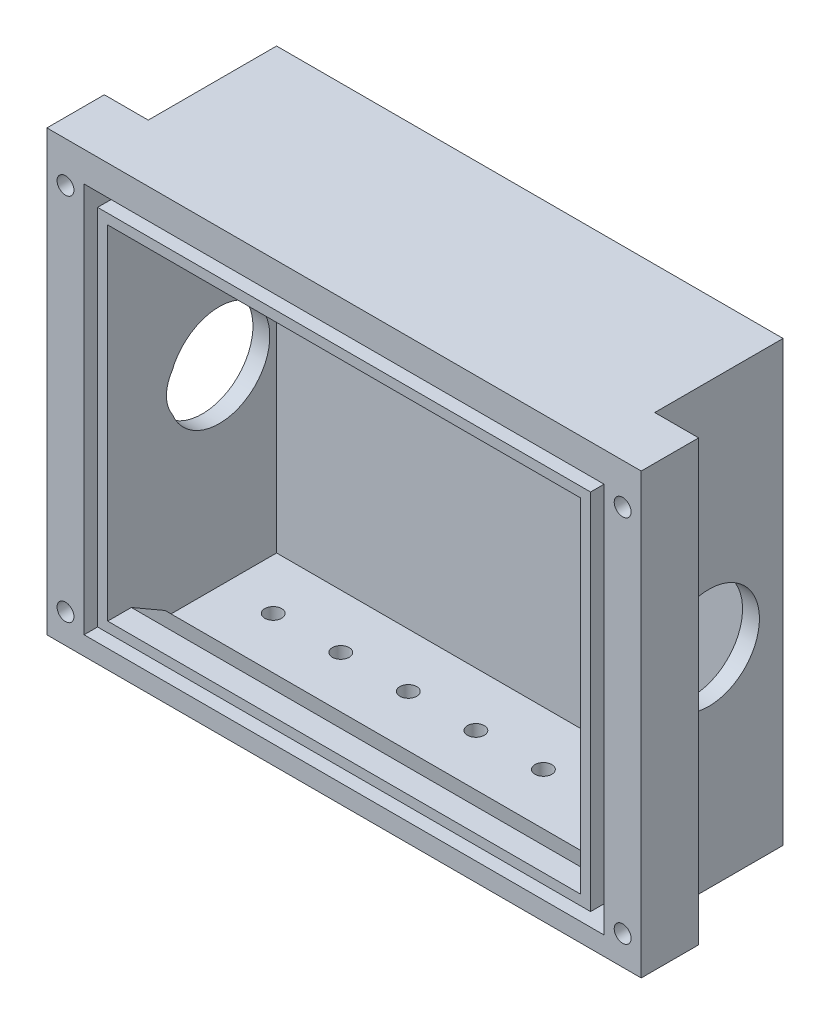
from build123d import *
from OCP.BRepFilletAPI import BRepFilletAPI_MakeChamfer

# Parameters (mm, degrees)
SKETCH1_R               = 172.5
BOSS_EXTRUDE1_DEPTH     = 10
SKETCH2_R               = 48.41
CUT_EXTRUDE1_DEPTH      = 10
BOSS_EXTRUDE2_DEPTH     = 5
CUT_EXTRUDE2_DEPTH      = 497
CUT_EXTRUDE6_START      = -497
CUT_EXTRUDE6_DEPTH      = 497
SKETCH6_W               = 195.767044214
SKETCH6_H               = 55
SKETCH6_W_2             = 185.767044214
SKETCH6_H_2             = 45
BOSS_EXTRUDE3_DEPTH     = 133.35
SKETCH7_W               = 185.767044214
SKETCH7_H               = 45
BOSS_EXTRUDE4_DEPTH     = 5
BOSS_EXTRUDE5_DEPTH     = 8
CHAMFER1_SIZE           = 8
CHAMFER1_SIZE2          = 6.250285012
CHAMFER1_PART_2_SIZE    = 8
CHAMFER1_PART_2_SIZE2   = 6.250285012
CHAMFER1_PART_3_SIZE    = 8
CHAMFER1_PART_3_SIZE2   = 6.250285012
FILLET1_R               = 38
SKETCH9_R               = 374.079334695
CUT_EXTRUDE7_DEPTH      = 93
CUT_EXTRUDE8_DEPTH      = 93
CUT_EXTRUDE8_DEPTH_BACK = 93
SKETCH10_R              = 229.38613092
SKETCH10_R_2            = 152.4
SKETCH11_W              = 291.443368419
SKETCH11_H              = 134.798764099
SKETCH11_W_2            = 144.967044214
SKETCH11_H_2            = 55
CUT_EXTRUDE9_DEPTH      = 143
SKETCH12_W              = 5
SKETCH12_H              = 55
BOSS_EXTRUDE6_DEPTH     = 133.35
SKETCH13_R              = 10
CUT_EXTRUDE10_DEPTH     = 58
SKETCH14_W              = 139.967044214
SKETCH14_H              = 45
BOSS_EXTRUDE7_DEPTH     = 5
SKETCH15_W              = 139.967044214
SKETCH15_H              = 123.35
CUT_EXTRUDE11_DEPTH     = 13
SKETCH16_W              = 10
SKETCH16_H              = 133.35
SKETCH16_W_2            = 149.967044214
BOSS_EXTRUDE9_DEPTH     = 17
SKETCH17_W              = 153.967044214
SKETCH17_H              = 115.6
SKETCH17_W_2            = 145.967044214
SKETCH17_H_2            = 107.6
CUT_EXTRUDE12_DEPTH     = 10
CHAMFER2_SIZE           = 10
CHAMFER2_SIZE2          = 5.773502692
SKETCH24_R              = 15
CUT_EXTRUDE16_DEPTH     = 177.5
SKETCH20_W              = 169.967044214
SKETCH20_H              = 3.35
CUT_EXTRUDE17_DEPTH     = 177.5
SKETCH25_W              = 139.967044214
SKETCH25_H              = 38.773502692
BOSS_EXTRUDE11_DEPTH    = 5
SKETCH26_W              = 3
SKETCH26_H              = 130
BOSS_EXTRUDE12_DEPTH    = 17
SKETCH18_R              = 2.5
CUT_EXTRUDE19_DEPTH     = 26
SKETCH27_W              = 48
SKETCH27_H              = 5
CUT_EXTRUDE20_DEPTH     = 23
SKETCH28_R              = 2.5
CUT_EXTRUDE21_DEPTH     = 10
SKETCH29_W              = 15
SKETCH29_H              = 30
BOSS_EXTRUDE13_DEPTH    = 10
SKETCH30_W              = 4
SKETCH30_H              = 23
CUT_EXTRUDE22_DEPTH     = 21
CHAMFER3_SIZE           = 6


with BuildPart() as part:
    # Sketch1 → Boss-Extrude1 (new body)
    with BuildSketch(Plane(origin=(0, 0, 0), x_dir=(1, 0, 0), z_dir=(0, 1, 0))):
        with Locations(Location((0, 0, 0), (0, 0, 270))):
            Circle(SKETCH1_R)
    extrude(amount=BOSS_EXTRUDE1_DEPTH)

    # Sketch2 → Cut-Extrude1 (cut)
    with BuildSketch(Plane(origin=(0, 10, 0), x_dir=(1, 0, 0), z_dir=(0, 1, 0))):
        with Locations((-75.91, -178.72)):
            Circle(SKETCH2_R)
        with Locations((75.91, -178.72)):
            Circle(SKETCH2_R)
    extrude(amount=-CUT_EXTRUDE1_DEPTH, mode=Mode.SUBTRACT)

    # Sketch3 → Boss-Extrude2 (add)
    with BuildSketch(Plane(origin=(0, 10, 0), x_dir=(1, 0, 0), z_dir=(0, 1, 0))):
        with BuildLine():
            Line((-98.968297449, -119.81), (98.968297449, -119.81))
            ThreePointArc((98.968297449, -119.81), (0, 155.4), (-98.968297449, -119.81))
        make_face()
        with BuildLine():
            ThreePointArc((97.883522107, -116.81), (0, 152.4), (-97.883522107, -116.81))
            Line((-97.883522107, -116.81), (97.883522107, -116.81))
        make_face(mode=Mode.SUBTRACT)
    extrude(amount=BOSS_EXTRUDE2_DEPTH)

    # Sketch4 → Cut-Extrude2 (cut)
    with BuildSketch(Plane(origin=(0, 10, 0), x_dir=(1, 0, 0), z_dir=(0, 1, 0))):
        Polygon((-28.261160255, -170.169200565), (28.261160255, -170.169200565), (28.261160255, -183.836149753), (-30.300470404, -183.836149753), align=None)
    extrude(amount=-CUT_EXTRUDE2_DEPTH, mode=Mode.SUBTRACT)

    # Sketch5 → Cut-Extrude6 (cut)
    with BuildSketch(Plane(origin=(0, 10, 0), x_dir=(1, 0, 0), z_dir=(0, 1, 0)).offset(CUT_EXTRUDE6_START)):
        with BuildLine():
            ThreePointArc((26.702080818, 170.420799435), (0, 172.5), (-26.702080818, 170.420799435))
            Line((-26.702080818, 170.420799435), (26.702080818, 170.420799435))
        make_face()
        with BuildLine():
            ThreePointArc((166.525, -45.007492432), (172.5, 0), (166.525, 45.007492432))
            Line((166.525, 45.007492432), (166.525, -45.007492432))
        make_face()
        with BuildLine():
            Line((-166.525, -45.007492432), (-166.525, 45.007492432))
            ThreePointArc((-166.525, 45.007492432), (-172.5, 0), (-166.525, -45.007492432))
        make_face()
    extrude(amount=CUT_EXTRUDE6_DEPTH, mode=Mode.SUBTRACT)

    # Sketch6 → Boss-Extrude3 (add)
    with BuildSketch(Plane(origin=(0, 10, 0), x_dir=(1, 0, 0), z_dir=(0, 1, 0))):
        with Locations((0, -89.31)):
            Rectangle(SKETCH6_W, SKETCH6_H)
        with Locations((0, -89.31)):
            Rectangle(SKETCH6_W_2, SKETCH6_H_2, mode=Mode.SUBTRACT)
    extrude(amount=BOSS_EXTRUDE3_DEPTH)

    # Sketch7 → Boss-Extrude4 (add)
    with BuildSketch(Plane(origin=(0, 10, 0), x_dir=(1, 0, 0), z_dir=(0, 1, 0))):
        with Locations((0, -89.31)):
            Rectangle(SKETCH7_W, SKETCH7_H)
    extrude(amount=BOSS_EXTRUDE4_DEPTH)

    # Sketch8 → Boss-Extrude5 (add)
    with BuildSketch(Plane(origin=(0, 10, 0), x_dir=(1, 0, 0), z_dir=(0, 1, 0))):
        with BuildLine():
            Line((-97.883522107, -61.81), (-112.883522107, -61.81))
            Line((-112.883522107, -61.81), (-112.883522107, -101.267136509))
            ThreePointArc((-112.883522107, -101.267136509), (-105.634768892, -108.807252061), (-97.883522107, -115.829782871))
            Line((-97.883522107, -115.829782871), (-97.883522107, -61.81))
        make_face()
        with BuildLine():
            Line((-88.028513968, -46.81), (-88.028513968, -61.81))
            Line((-88.028513968, -61.81), (97.883522107, -61.81))
            Line((97.883522107, -61.81), (97.883522107, -115.829782871))
            ThreePointArc((97.883522107, -115.829782871), (105.634768892, -108.807252061), (112.883522107, -101.267136509))
            Line((112.883522107, -101.267136509), (112.883522107, -46.81))
            Line((112.883522107, -46.81), (-88.028513968, -46.81))
        make_face()
    extrude(amount=BOSS_EXTRUDE5_DEPTH)

    # Chamfer1
    chamfer1_edges = [part.edges().sort_by_distance(p)[0] for p in [
        (-97.883522107, 18, 88.819891436),
    ]]
    chamfer1_side = [part.faces().sort_by_distance(p)[0] for p in [
        (-97.883522107, 80.599247918, 89.340686997),
    ]]
    chamfer(chamfer1_edges, length=CHAMFER1_SIZE, length2=CHAMFER1_SIZE2, reference=chamfer1_side[0])

    # Chamfer1 part 2
    chamfer1_part_2_edges = [part.edges().sort_by_distance(p)[0] for p in [
        (4.927504069, 18, 61.81),
    ]]
    chamfer1_part_2_side = [part.faces().sort_by_distance(p)[0] for p in [
        (-0.807441513, 80.139082253, 61.81),
    ]]
    chamfer(chamfer1_part_2_edges, length=CHAMFER1_PART_2_SIZE, length2=CHAMFER1_PART_2_SIZE2, reference=chamfer1_part_2_side[0])

    # Chamfer1 part 3
    chamfer1_part_3_edges = [part.edges().sort_by_distance(p)[0] for p in [
        (97.883522107, 18, 88.819891436),
    ]]
    chamfer1_part_3_side = [part.faces().sort_by_distance(p)[0] for p in [
        (97.883522107, 80.599247918, 89.340686997),
    ]]
    chamfer(chamfer1_part_3_edges, length=CHAMFER1_PART_3_SIZE, length2=CHAMFER1_PART_3_SIZE2, reference=chamfer1_part_3_side[0])

    # Fillet1
    # the kernel refuses this fillet: 38 mm, written as the material it adds along each edge
    with BuildSketch(Plane(origin=(-97.883522107, 26, 148.028657271), x_dir=(-0.61566147532566, -0.7880107536067207, 0), z_dir=(0, 0, -1))) as fillet1_piece_1_section:
        with BuildLine():
            CenterArc((13.24591235, 37.873851244), FILLET1_R, 232, 33.330100487)
            Line((-10.149223713, 7.929442607), (0, 0))
            Line((0, 0), (10.152145721, 0))
        make_face()
    fillet1_piece_1 = extrude(amount=86.218657271, mode=Mode.PRIVATE)
    fillet1_piece_1 = fillet1_piece_1 & Plane(origin=(0, 26, 0), x_dir=(-0.7443687577094257, 0, 0.6677687867414337), z_dir=(0, -1, 0)) * Cylinder(151.65, 214, mode=Mode.PRIVATE)
    add(fillet1_piece_1)
    with BuildSketch(Plane(origin=(-88.028513968, 26, 61.81), x_dir=(0, 1, 0), z_dir=(1, 0, 0))) as fillet1_piece_2_section:
        with BuildLine():
            CenterArc((12.87954976, -38), FILLET1_R, 90, 33.330100487)
            Line((-8, -6.250285012), (0, 0))
            Line((0, 0), (12.87954976, 0))
        make_face()
    fillet1_piece_2 = extrude(amount=218.110910475, mode=Mode.PRIVATE)
    fillet1_piece_2 = fillet1_piece_2 - Plane(origin=(135.883522107, 38.87954976, 61.81), x_dir=(-0.8355188154722692, -0.5494618357919104, 0), z_dir=(0, 0, -1)) * Cylinder(38, 488, mode=Mode.PRIVATE)
    add(fillet1_piece_2)
    with BuildSketch(Plane(origin=(97.883522107, 26, 29.6111256), x_dir=(0.61566147532566, -0.7880107536067207, 0), z_dir=(0, 0, 1))) as fillet1_piece_3_section:
        with BuildLine():
            CenterArc((13.24591235, 37.873851244), FILLET1_R, 232, 33.330100487)
            Line((-10.149223713, 7.929442607), (0, 0))
            Line((0, 0), (10.152145721, 0))
        make_face()
    fillet1_piece_3 = extrude(amount=118.417531672, mode=Mode.PRIVATE)
    fillet1_piece_3 = fillet1_piece_3 & Plane(origin=(0, 26, 0), x_dir=(0.6454567893612635, 0, 0.7637967878090673), z_dir=(0, -1, 0)) * Cylinder(151.65, 278, mode=Mode.PRIVATE)
    fillet1_piece_3 = fillet1_piece_3 - Plane(origin=(97.883522107, 38.87954976, 23.81), x_dir=(0, 0, 1), z_dir=(-1, 0, 0)) * Cylinder(38, 278, mode=Mode.PRIVATE)
    add(fillet1_piece_3)

    # Sketch9 → Cut-Extrude7 (cut)
    with BuildSketch(Plane(origin=(0, 10, 0), x_dir=(1, 0, 0), z_dir=(0, 1, 0))):
        Circle(SKETCH9_R)
    extrude(amount=-CUT_EXTRUDE7_DEPTH, mode=Mode.SUBTRACT)

    # Sketch10 → Cut-Extrude8 (cut, two sides: drawn at the far end of the back side and taken through both)
    with BuildSketch(Plane.XZ.offset(-10).offset(-CUT_EXTRUDE8_DEPTH_BACK)):
        Circle(SKETCH10_R)
        Circle(SKETCH10_R_2, mode=Mode.SUBTRACT)
    extrude(amount=CUT_EXTRUDE8_DEPTH + CUT_EXTRUDE8_DEPTH_BACK, mode=Mode.SUBTRACT)

    # Sketch11 → Cut-Extrude9 (cut)
    with BuildSketch(Plane(origin=(0, 143.35, 0), x_dir=(1, 0, 0), z_dir=(0, 1, 0))):
        with Locations((4.840839595, -88.771460056)):
            Rectangle(SKETCH11_W, SKETCH11_H)
        with Locations((-25.4, -89.31)):
            Rectangle(SKETCH11_W_2, SKETCH11_H_2, mode=Mode.SUBTRACT)
    extrude(amount=-CUT_EXTRUDE9_DEPTH, mode=Mode.SUBTRACT)

    # Sketch12 → Boss-Extrude6 (add)
    with BuildSketch(Plane(origin=(0, 143.35, 0), x_dir=(1, 0, 0), z_dir=(0, 1, 0))):
        with Locations((49.583522107, -89.31)):
            Rectangle(SKETCH12_W, SKETCH12_H)
    extrude(amount=-BOSS_EXTRUDE6_DEPTH)

    # Sketch13 → Cut-Extrude10 (cut)
    with BuildSketch(Plane.ZY.offset(97.883522107)):
        with Locations((89.418847681, 75)):
            Circle(SKETCH13_R)
    extrude(amount=-CUT_EXTRUDE10_DEPTH, mode=Mode.SUBTRACT)

    # Sketch14 → Boss-Extrude7 (add)
    with BuildSketch(Plane(origin=(0, 143.35, 0), x_dir=(1, 0, 0), z_dir=(0, 1, 0))):
        with Locations((-22.9, -89.31)):
            Rectangle(SKETCH14_W, SKETCH14_H)
    extrude(amount=-BOSS_EXTRUDE7_DEPTH)

    # Sketch15 → Cut-Extrude11 (cut)
    with BuildSketch(Plane.XY.offset(116.81)):
        with Locations((-22.9, 76.675)):
            Rectangle(SKETCH15_W, SKETCH15_H)
    extrude(amount=-CUT_EXTRUDE11_DEPTH, mode=Mode.SUBTRACT)

    # Sketch16 → Boss-Extrude9 (add)
    # profile 1 of 5: a face of its own
    with BuildSketch(Plane.XY.offset(116.81)):
        with Locations((-102.883522107, 76.675)):
            Rectangle(SKETCH16_W, SKETCH16_H)
    # profile 2 of 5: a face of its own
    with BuildSketch(Plane.XY.offset(116.81)):
        with Locations((-22.9, 76.675)):
            Rectangle(SKETCH16_W_2, SKETCH16_H)
        Polygon((-92.883522107, 127.475), (-92.883522107, 138.35), (47.083522107, 138.35), (47.083522107, 127.475), (47.083522107, 76.675), (47.083522107, 25.875), (47.083522107, 15), (-92.883522107, 15), (-92.883522107, 25.875), (-92.883522107, 76.675), align=None, mode=Mode.SUBTRACT)
    # profile 3 of 5: a face of its own
    with BuildSketch(Plane.XY.offset(116.81)):
        with Locations((57.083522107, 76.675)):
            Rectangle(SKETCH16_W, SKETCH16_H)
    # profile 4 of 5: a face of its own
    with BuildSketch(Plane.XY.offset(116.81)):
        Polygon((47.083522107, 138.35), (-92.883522107, 138.35), (-92.883522107, 127.475), (-22.9, 127.475), (47.083522107, 127.475), align=None)
    # profile 5 of 5: a face of its own
    with BuildSketch(Plane.XY.offset(116.81)):
        Polygon((-22.9, 25.875), (-92.883522107, 25.875), (-92.883522107, 15), (47.083522107, 15), (47.083522107, 25.875), align=None)
    extrude(amount=-BOSS_EXTRUDE9_DEPTH)

    # Sketch17 → Cut-Extrude12 (cut)
    with BuildSketch(Plane.XY.offset(116.81)):
        with Locations((-22.9, 76.675)):
            Rectangle(SKETCH17_W, SKETCH17_H)
        with Locations((-22.9, 76.675)):
            Rectangle(SKETCH17_W_2, SKETCH17_H_2, mode=Mode.SUBTRACT)
    extrude(amount=-CUT_EXTRUDE12_DEPTH, mode=Mode.SUBTRACT)

    # Chamfer2: one chamfer whose edges measure the first distance from different faces: ONE call of the kernel's chamfer builder (chamfer() names one face for all edges)
    chamfer2_edges_1 = [part.edges().sort_by_distance(p)[0] for p in [
        (-22.9, 25.875, 99.81),
    ]]
    chamfer2_side_1 = [part.faces().sort_by_distance(p)[0] for p in [
        (-22.9, 25.875, 108.31),
    ]]
    chamfer2_edges_2 = [part.edges().sort_by_distance(p)[0] for p in [
        (-22.9, 127.475, 99.81),
    ]]
    chamfer2_side_2 = [part.faces().sort_by_distance(p)[0] for p in [
        (-22.9, 132.9125, 99.81),
    ]]
    chamfer2 = BRepFilletAPI_MakeChamfer(part.part.solid().wrapped)
    for e in chamfer2_edges_1:
        chamfer2.Add(CHAMFER2_SIZE, CHAMFER2_SIZE2, e.wrapped, chamfer2_side_1[0].wrapped)  # the first distance lies on this face
    for e in chamfer2_edges_2:
        chamfer2.Add(CHAMFER2_SIZE, CHAMFER2_SIZE2, e.wrapped, chamfer2_side_2[0].wrapped)  # the first distance lies on this face
    add(Compound.cast(chamfer2.Shape()), mode=Mode.REPLACE)

    # Sketch24 → Cut-Extrude16 (cut)
    with BuildSketch(Plane.ZY.offset(97.883522107)):
        with Locations((83.81, 75)):
            Circle(SKETCH24_R)
    extrude(amount=-CUT_EXTRUDE16_DEPTH, mode=Mode.SUBTRACT)

    # Sketch20 → Cut-Extrude17 (cut)
    with BuildSketch(Plane.XY.offset(116.81)):
        with Locations((-22.9, 11.675)):
            Rectangle(SKETCH20_W, SKETCH20_H)
    extrude(amount=-CUT_EXTRUDE17_DEPTH, mode=Mode.SUBTRACT)

    # Sketch25 → Boss-Extrude11 (add)
    with BuildSketch(Plane(origin=(0, 13.35, 0), x_dir=(-1, 0, 0), z_dir=(0, -1, 0))):
        with Locations((22.9, -86.196751346)):
            Rectangle(SKETCH25_W, SKETCH25_H)
    extrude(amount=-BOSS_EXTRUDE11_DEPTH)

    # Sketch26 → Boss-Extrude12 (add)
    with BuildSketch(Plane.XY.offset(116.81)):
        with Locations((-109.383522107, 78.35)):
            Rectangle(SKETCH26_W, SKETCH26_H)
        with Locations((63.583522107, 78.35)):
            Rectangle(SKETCH26_W, SKETCH26_H)
    extrude(amount=-BOSS_EXTRUDE12_DEPTH)

    # Sketch18 → Cut-Extrude19 (cut)
    with BuildSketch(Plane.XY.offset(116.81)):
        with Locations((-105.383522107, 22)):
            Circle(SKETCH18_R)
        with Locations((59.583522107, 22)):
            Circle(SKETCH18_R)
        with Locations((59.583522107, 131.35)):
            Circle(SKETCH18_R)
        with Locations((-105.383522107, 131.35)):
            Circle(SKETCH18_R)
    extrude(amount=-CUT_EXTRUDE19_DEPTH, mode=Mode.SUBTRACT)

    # Sketch27 → Cut-Extrude20 (cut)
    with BuildSketch(Plane.XY.offset(66.81)):
        with Locations((11.083522107, 130.85)):
            Rectangle(SKETCH27_W, SKETCH27_H)
    extrude(amount=-CUT_EXTRUDE20_DEPTH, mode=Mode.SUBTRACT)

    # Sketch28 → Cut-Extrude21 (cut)
    with BuildSketch(Plane(origin=(0, 18.35, 0), x_dir=(1, 0, 0), z_dir=(0, 1, 0))):
        with Locations(Location((-77.883522107, -82.81, 0), (0, 0, 270))):
            Circle(SKETCH28_R)
        with Locations(Location((-57.883522107, -82.81, 0), (0, 0, 270))):
            Circle(SKETCH28_R)
        with Locations(Location((-37.883522107, -82.81, 0), (0, 0, 270))):
            Circle(SKETCH28_R)
        with Locations(Location((-17.883522107, -82.81, 0), (0, 0, 270))):
            Circle(SKETCH28_R)
        with Locations(Location((2.116477893, -82.81, 0), (0, 0, 270))):
            Circle(SKETCH28_R)
        with Locations(Location((22.116477893, -82.81, 0), (0, 0, 270))):
            Circle(SKETCH28_R)
    extrude(amount=-CUT_EXTRUDE21_DEPTH, mode=Mode.SUBTRACT)

    # Sketch29 → Boss-Extrude13 (add)
    with BuildSketch(Plane(origin=(0, 0, 61.81), x_dir=(-1, 0, 0), z_dir=(0, 0, -1))):
        with Locations((47.190948631, 83.35)):
            Rectangle(SKETCH29_W, SKETCH29_H)
    extrude(amount=BOSS_EXTRUDE13_DEPTH)

    # Sketch30 → Cut-Extrude22 (cut)
    with BuildSketch(Plane.ZY.offset(54.690948631)):
        with Locations((59.81, 83.35)):
            Rectangle(SKETCH30_W, SKETCH30_H)
    extrude(amount=-CUT_EXTRUDE22_DEPTH, mode=Mode.SUBTRACT)

    # Chamfer3
    chamfer3_edges = [part.edges().sort_by_distance(p)[0] for p in [
        (-47.190948631, 68.35, 61.81),
        (-47.190948631, 98.35, 61.81),
    ]]
    chamfer(chamfer3_edges, length=CHAMFER3_SIZE)


solid = part.part
